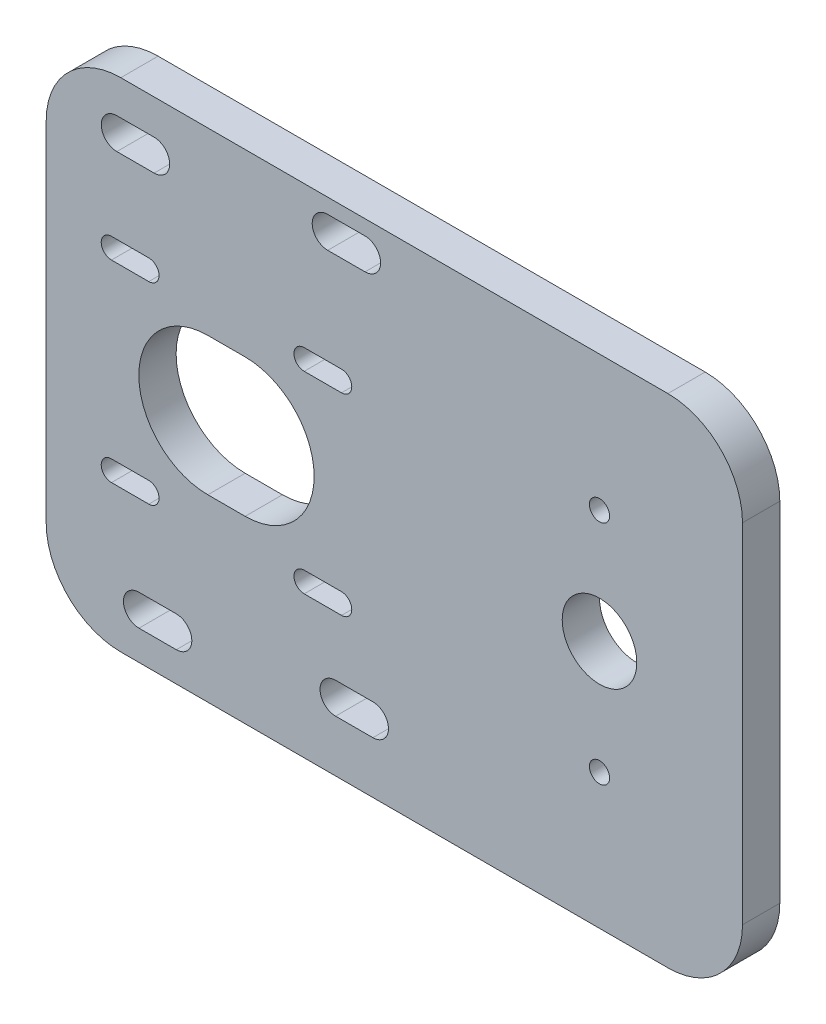
from build123d import *

# Parameters (mm, degrees)
CROQUIS1_W              = 112
CROQUIS1_H              = 80
SALIENTE_EXTRUIR1_DEPTH = 6
CROQUIS2_R              = 6
CROQUIS2_R_2            = 1.625
CORTAR_EXTRUIR1_DEPTH   = 138.767920794
REDONDEO1_R             = 12


with BuildPart() as part:
    # Croquis1 → Saliente-Extruir1 (new body)
    with BuildSketch(Plane.XY):
        with Locations((56, 40)):
            Rectangle(CROQUIS1_W, CROQUIS1_H)
    extrude(amount=SALIENTE_EXTRUIR1_DEPTH)

    # Croquis2 → Cortar-Extruir1 (cut, through all)
    with BuildSketch(Plane(origin=(0, 0, 0), x_dir=(-1, 0, 0), z_dir=(0, 0, -1))):
        with Locations((-89, 40)):
            Circle(CROQUIS2_R)
        with Locations((-89, 21.75)):
            Circle(CROQUIS2_R_2)
        with Locations((-89, 58.25)):
            Circle(CROQUIS2_R_2)
        with BuildLine():
            Line((-26, 28.9), (-32, 28.9))
            ThreePointArc((-32, 28.9), (-43.1, 40), (-32, 51.1))
            Line((-32, 51.1), (-26, 51.1))
            ThreePointArc((-26, 51.1), (-14.9, 40), (-26, 28.9))
        make_face()
        with BuildLine():
            Line((-10.5, 22.85), (-16.5, 22.85))
            ThreePointArc((-16.5, 22.85), (-18.15, 24.5), (-16.5, 26.15))
            Line((-16.5, 26.15), (-10.5, 26.15))
            ThreePointArc((-10.5, 26.15), (-8.85, 24.5), (-10.5, 22.85))
        make_face()
        with BuildLine():
            Line((-41.5, 53.85), (-47.5, 53.85))
            ThreePointArc((-47.5, 53.85), (-49.15, 55.5), (-47.5, 57.15))
            Line((-47.5, 57.15), (-41.5, 57.15))
            ThreePointArc((-41.5, 57.15), (-39.85, 55.5), (-41.5, 53.85))
        make_face()
        with BuildLine():
            Line((-41.5, 22.85), (-47.5, 22.85))
            ThreePointArc((-47.5, 22.85), (-49.15, 24.5), (-47.5, 26.15))
            Line((-47.5, 26.15), (-41.5, 26.15))
            ThreePointArc((-41.5, 26.15), (-39.85, 24.5), (-41.5, 22.85))
        make_face()
        with BuildLine():
            Line((-10.5, 53.85), (-16.5, 53.85))
            ThreePointArc((-16.5, 53.85), (-18.15, 55.5), (-16.5, 57.15))
            Line((-16.5, 57.15), (-10.5, 57.15))
            ThreePointArc((-10.5, 57.15), (-8.85, 55.5), (-10.5, 53.85))
        make_face()
        with BuildLine():
            Line((-46.550008768, 8.334745358), (-52.550008768, 8.334745358))
            ThreePointArc((-52.550008768, 8.334745358), (-55.050008768, 10.834745358), (-52.550008768, 13.334745358))
            Line((-52.550008768, 13.334745358), (-46.550008768, 13.334745358))
            ThreePointArc((-46.550008768, 13.334745358), (-44.050008768, 10.834745358), (-46.550008768, 8.334745358))
        make_face()
        with BuildLine():
            Line((-14.92400901, 4.780807243), (-20.92400901, 4.780807243))
            ThreePointArc((-20.92400901, 4.780807243), (-23.42400901, 7.280807243), (-20.92400901, 9.780807243))
            Line((-20.92400901, 9.780807243), (-14.92400901, 9.780807243))
            ThreePointArc((-14.92400901, 9.780807243), (-12.42400901, 7.280807243), (-14.92400901, 4.780807243))
        make_face()
        with BuildLine():
            Line((-45.286554411, 72.596157219), (-51.286554411, 72.596157219))
            ThreePointArc((-51.286554411, 72.596157219), (-53.786554411, 75.096157219), (-51.286554411, 77.596157219))
            Line((-51.286554411, 77.596157219), (-45.286554411, 77.596157219))
            ThreePointArc((-45.286554411, 77.596157219), (-42.786554411, 75.096157219), (-45.286554411, 72.596157219))
        make_face()
        with BuildLine():
            Line((-11.360795067, 69.390903541), (-17.360795067, 69.390903541))
            ThreePointArc((-17.360795067, 69.390903541), (-19.860795067, 71.890903541), (-17.360795067, 74.390903541))
            Line((-17.360795067, 74.390903541), (-11.360795067, 74.390903541))
            ThreePointArc((-11.360795067, 74.390903541), (-8.860795067, 71.890903541), (-11.360795067, 69.390903541))
        make_face()
    extrude(amount=-CORTAR_EXTRUIR1_DEPTH, mode=Mode.SUBTRACT)

    # Redondeo1
    redondeo1_edges = [part.edges().sort_by_distance(p)[0] for p in [
        (112, 0, 3),
        (112, 80, 3),
        (0, 0, 3),
        (0, 80, 3),
    ]]
    fillet(redondeo1_edges, radius=REDONDEO1_R)


solid = part.part
